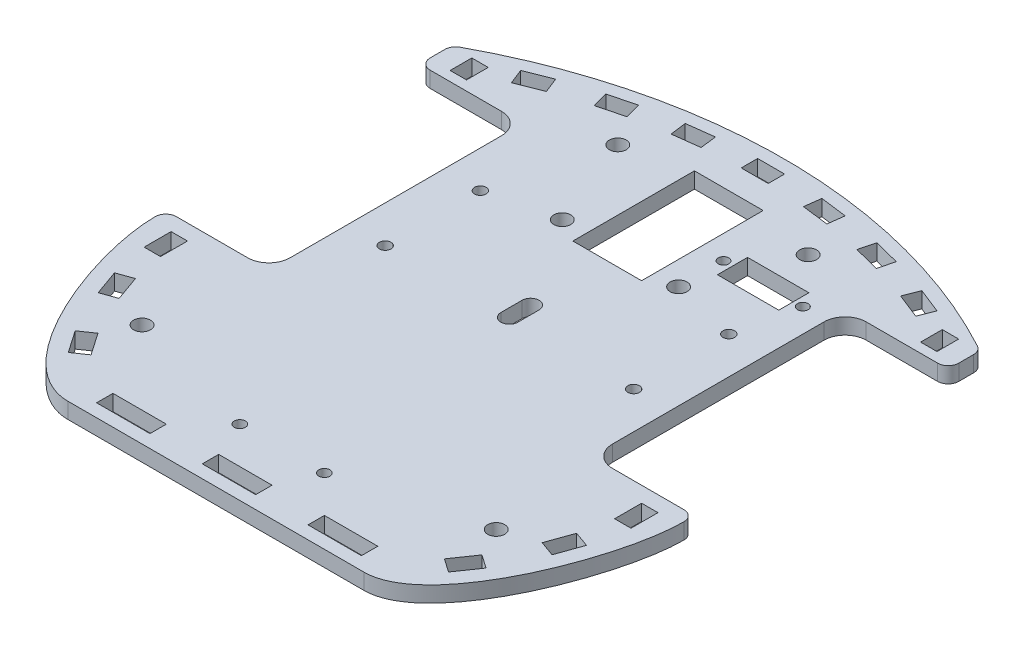
from build123d import *

# Parameters (mm, degrees)
CROQUIS1_W              = 61
CROQUIS1_H              = 100
SALIENTE_EXTRUIR1_DEPTH = 3
CROQUIS7_W              = 19.5
CROQUIS7_H              = 40.5
SALIENTE_EXTRUIR4_DEPTH = 3
CROQUIS17_W             = 61
CROQUIS17_H             = 3.5
CORTAR_EXTRUIR10_DEPTH  = 10
CROQUIS2_R              = 1.1
CROQUIS2_R_2            = 1.05
CORTAR_EXTRUIR1_DEPTH   = 3
CROQUIS8_W              = 13
CROQUIS8_H              = 23
CORTAR_EXTRUIR3_DEPTH   = 10
CROQUIS3_R              = 1.6
CORTAR_EXTRUIR2_DEPTH   = 82.665476182
CROQUIS12_R             = 1.6
CORTAR_EXTRUIR6_DEPTH   = 82.665476182
CORTAR_EXTRUIR7_DEPTH   = 82.665476182
REDONDEO2_R             = 4
REDONDEO3_R             = 2
CORTAR_EXTRUIR8_DEPTH   = 10
MATRIZ_CRV1_OUTLINE_W   = 5.1
MATRIZ_CRV1_OUTLINE_H   = 3.1
MATRIZ_CRV1_DEPTH       = 3
CROQUIS16_W             = 3.1
CROQUIS16_H             = 4.1
CROQUIS16_H_2           = 5.1
CORTAR_EXTRUIR9_DEPTH   = 3
CORTAR_EXTRUIR13_DEPTH  = 82.665476326
CROQUIS18_W             = 10.1
CROQUIS18_H             = 3.1
CORTAR_EXTRUIR11_DEPTH  = 10
CROQUIS9_R              = 1
CROQUIS9_W              = 11.6
CROQUIS9_H              = 5.7
CORTAR_EXTRUIR4_DEPTH   = 10


# Read off the part's stored shape, not the designer's step: Matriz Crv1
with BuildPart() as part:
    # Croquis1 → Saliente-Extruir1 (new body)
    with BuildSketch(Plane(origin=(0, 0, 0), x_dir=(1, 0, 0), z_dir=(0, 1, 0))):
        with Locations((0, -18)):
            Rectangle(CROQUIS1_W, CROQUIS1_H)
    extrude(amount=SALIENTE_EXTRUIR1_DEPTH)

    # Croquis7 → Saliente-Extruir4 (add, through all)
    with BuildSketch(Plane(origin=(0, 3, 0), x_dir=(1, 0, 0), z_dir=(0, 1, 0))):
        with BuildLine():
            Line((-30.5, 24), (-30.5, 32))
            Line((-30.5, 32), (30.5, 32))
            Line((30.5, 32), (30.5, 24))
            Line((30.5, 24), (50, 24))
            Line((50, 24), (50, 30))
            ThreePointArc((50, 30), (0, 42.950013881), (-50, 30))
            Line((-50, 30), (-50, 24))
            Line((-50, 24), (-30.5, 24))
        make_face()
        with Locations((-40.25, -44.25)):
            Rectangle(CROQUIS7_W, CROQUIS7_H)
        with Locations((40.25, -44.25)):
            Rectangle(CROQUIS7_W, CROQUIS7_H)
    extrude(amount=-SALIENTE_EXTRUIR4_DEPTH)

    # Croquis17 → Cortar-Extruir10 (cut)
    with BuildSketch(Plane(origin=(0, 3, 0), x_dir=(1, 0, 0), z_dir=(0, 1, 0))):
        with Locations((0, -66.25)):
            Rectangle(CROQUIS17_W, CROQUIS17_H)
    extrude(amount=-CORTAR_EXTRUIR10_DEPTH, mode=Mode.SUBTRACT)

    # Croquis2 → Cortar-Extruir1 (cut)
    with BuildSketch(Plane(origin=(0, 3, 0), x_dir=(1, 0, 0), z_dir=(0, 1, 0))):
        with Locations(Location((23.5, 9, 0), (0, 0, 270))):
            Circle(CROQUIS2_R)
        with Locations(Location((23.5, -9, 0), (0, 0, 270))):
            Circle(CROQUIS2_R)
        with Locations(Location((-23.5, 9, 0), (0, 0, 270))):
            Circle(CROQUIS2_R)
        with Locations(Location((-23.5, -9, 0), (0, 0, 270))):
            Circle(CROQUIS2_R)
        with Locations(Location((-8, -52, 0), (0, 0, 270))):
            Circle(CROQUIS2_R_2)
        with Locations(Location((8, -52, 0), (0, 0, 270))):
            Circle(CROQUIS2_R_2)
    extrude(amount=-CORTAR_EXTRUIR1_DEPTH, mode=Mode.SUBTRACT)

    # Croquis8 → Cortar-Extruir3 (cut)
    with BuildSketch(Plane(origin=(0, 3, 0), x_dir=(1, 0, 0), z_dir=(0, 1, 0))):
        with Locations((0, 21)):
            Rectangle(CROQUIS8_W, CROQUIS8_H)
    extrude(amount=-CORTAR_EXTRUIR3_DEPTH, mode=Mode.SUBTRACT)

    # Croquis3 → Cortar-Extruir2 (cut, through all)
    with BuildSketch(Plane(origin=(0, 3, 0), x_dir=(1, 0, 0), z_dir=(0, 1, 0))):
        with Locations(Location((-11, 12, 0), (0, 0, 270))):
            Circle(CROQUIS3_R)
        with Locations(Location((11, 12, 0), (0, 0, 270))):
            Circle(CROQUIS3_R)
        with Locations(Location((-33.5, -45, 0), (0, 0, 270))):
            Circle(CROQUIS3_R)
        with Locations(Location((33.5, -45, 0), (0, 0, 270))):
            Circle(CROQUIS3_R)
        with BuildLine():
            Line((-1.6, -9), (-1.6, -5))
            ThreePointArc((-1.6, -5), (0, -3.4), (1.6, -5))
            Line((1.6, -5), (1.6, -9))
            ThreePointArc((1.6, -9), (0, -10.6), (-1.6, -9))
        make_face()
    extrude(amount=-CORTAR_EXTRUIR2_DEPTH, mode=Mode.SUBTRACT)

    # Croquis12 → Cortar-Extruir6 (cut, through all)
    with BuildSketch(Plane(origin=(0, 3, 0), x_dir=(1, 0, 0), z_dir=(0, 1, 0))):
        with Locations(Location((-18, 29.5, 0), (0, 0, 270))):
            Circle(CROQUIS12_R)
        with Locations(Location((18, 29.5, 0), (0, 0, 270))):
            Circle(CROQUIS12_R)
    extrude(amount=-CORTAR_EXTRUIR6_DEPTH, mode=Mode.SUBTRACT)

    # Croquis14 → Cortar-Extruir7 (cut, through all)
    with BuildSketch(Plane(origin=(0, 3, 0), x_dir=(1, 0, 0), z_dir=(0, 1, 0))):
        with BuildLine():
            Line((-50, -26), (-50, -64.5))
            Line((-50, -64.5), (-28, -64.5))
            add(Edge.make_bspline(
                [(-50, -26), (-50, -38), (-40, -64.5), (-28, -64.5)],
                knots=[0, 0, 0, 0, 1, 1, 1, 1], degree=3))
        make_face()
    cortar_extruir7 = extrude(amount=-CORTAR_EXTRUIR7_DEPTH, mode=Mode.SUBTRACT)

    # Redondeo2
    redondeo2_edges = [part.edges().sort_by_distance(p)[0] for p in [
        (30.5, 1.5, -24),
        (-30.5, 1.5, -24),
        (-30.5, 1.5, 24),
        (30.5, 1.5, 24),
    ]]
    fillet(redondeo2_edges, radius=REDONDEO2_R)

    # Redondeo3
    redondeo3_edges = [part.edges().sort_by_distance(p)[0] for p in [
        (-50, 1.5, -30),
        (50, 1.5, -30),
        (50, 1.5, -24),
        (-50, 1.5, -24),
        (-50, 1.5, 24),
        (50, 1.5, 24),
    ]]
    fillet(redondeo3_edges, radius=REDONDEO3_R - 0.0001)  # a hair under: the kernel refuses the full size

    # Croquis15 → Cortar-Extruir8 (cut)
    with BuildSketch(Plane(origin=(0, 3, 0), x_dir=(1, 0, 0), z_dir=(0, 1, 0))):
        Polygon((-38.239465907, 29.620233281), (-33.497496925, 31.497393416), (-34.638515831, 34.379766719), (-39.380484813, 32.502606584), align=None)
    extrude(amount=-CORTAR_EXTRUIR8_DEPTH, mode=Mode.SUBTRACT)

    # Matriz Crv1 outline → Matriz Crv1 (cut)
    with BuildSketch(Plane(origin=(0, 0, 0), x_dir=(1, 0, 0), z_dir=(0, 1, 0))):
        Polygon((39.380484813, 32.502606584), (34.638515831, 34.379766719), (33.497496925, 31.497393416), (38.239465907, 29.620233281), align=None)
        Polygon((27.471913222, 36.707954041), (22.532090053, 37.976081424), (21.761267526, 34.973443811), (26.701090695, 33.705316428), align=None)
        Polygon((15.130226298, 39.387839944), (10.070428962, 40.026941594), (9.68195541, 36.951378508), (14.741752746, 36.312276858), align=None)
        with Locations((0, 38.950013881)):
            Rectangle(MATRIZ_CRV1_OUTLINE_W, MATRIZ_CRV1_OUTLINE_H)
        Polygon((-10.070428962, 40.026941594), (-15.130226298, 39.387839944), (-14.741752746, 36.312276858), (-9.68195541, 36.951378508), align=None)
        Polygon((-22.532090053, 37.976081424), (-27.471913222, 36.707954041), (-26.701090695, 33.705316428), (-21.761267526, 34.973443811), align=None)
    extrude(amount=MATRIZ_CRV1_DEPTH, mode=Mode.SUBTRACT)

    # Croquis16 → Cortar-Extruir9 (cut)
    with BuildSketch(Plane(origin=(0, 3, 0), x_dir=(1, 0, 0), z_dir=(0, 1, 0))):
        with Locations((-44.5, 27.885018263)):
            Rectangle(CROQUIS16_W, CROQUIS16_H)
        with Locations((-44.5, -29.5)):
            Rectangle(CROQUIS16_W, CROQUIS16_H_2)
    cortar_extruir9 = extrude(amount=-CORTAR_EXTRUIR9_DEPTH, mode=Mode.SUBTRACT)

    # Croquis19 → Cortar-Extruir13 (cut, through all)
    with BuildSketch(Plane(origin=(0, 3, 0), x_dir=(1, 0, 0), z_dir=(0, 1, 0))):
        Polygon((-40.014205747, -42.823860895), (-41.724634952, -38.019234798), (-44.645093952, -39.058907452), (-42.934664747, -43.863533549), align=None)
        Polygon((-38.866197007, -52.280851683), (-35.970669214, -56.479175015), (-33.418747189, -54.719148317), (-36.314274981, -50.520824985), align=None)
    cortar_extruir13 = extrude(amount=-CORTAR_EXTRUIR13_DEPTH, mode=Mode.SUBTRACT)

    # Simetría1: Cortar-Extruir7, Cortar-Extruir9, Cortar-Extruir13 across plane
    add(cortar_extruir7.mirror(Plane(origin=(0, 0, 0), x_dir=(0, 0, 1), z_dir=(1, 0, 0))), mode=Mode.SUBTRACT)
    add(cortar_extruir9.mirror(Plane(origin=(0, 0, 0), x_dir=(0, 0, 1), z_dir=(1, 0, 0))), mode=Mode.SUBTRACT)
    add(cortar_extruir13.mirror(Plane(origin=(0, 0, 0), x_dir=(0, 0, 1), z_dir=(1, 0, 0))), mode=Mode.SUBTRACT)

    # Croquis18 → Cortar-Extruir11 (cut)
    with BuildSketch(Plane(origin=(0, 3, 0), x_dir=(1, 0, 0), z_dir=(0, 1, 0))):
        with Locations((0, -60.5)):
            Rectangle(CROQUIS18_W, CROQUIS18_H)
        with Locations((20, -60.5)):
            Rectangle(CROQUIS18_W, CROQUIS18_H)
        with Locations((-20, -60.5)):
            Rectangle(CROQUIS18_W, CROQUIS18_H)
    extrude(amount=-CORTAR_EXTRUIR11_DEPTH, mode=Mode.SUBTRACT)

    # Croquis9 → Cortar-Extruir4 (cut)
    with BuildSketch(Plane(origin=(0, 3, 0), x_dir=(1, 0, 0), z_dir=(0, 1, 0))):
        with Locations(Location((11, 20.5, 0), (0, 0, 270))):
            Circle(CROQUIS9_R)
        with Locations(Location((26, 20.5, 0), (0, 0, 270))):
            Circle(CROQUIS9_R)
        with Locations((18.5, 20.5)):
            Rectangle(CROQUIS9_W, CROQUIS9_H)
    extrude(amount=-CORTAR_EXTRUIR4_DEPTH, mode=Mode.SUBTRACT)


solid = part.part
